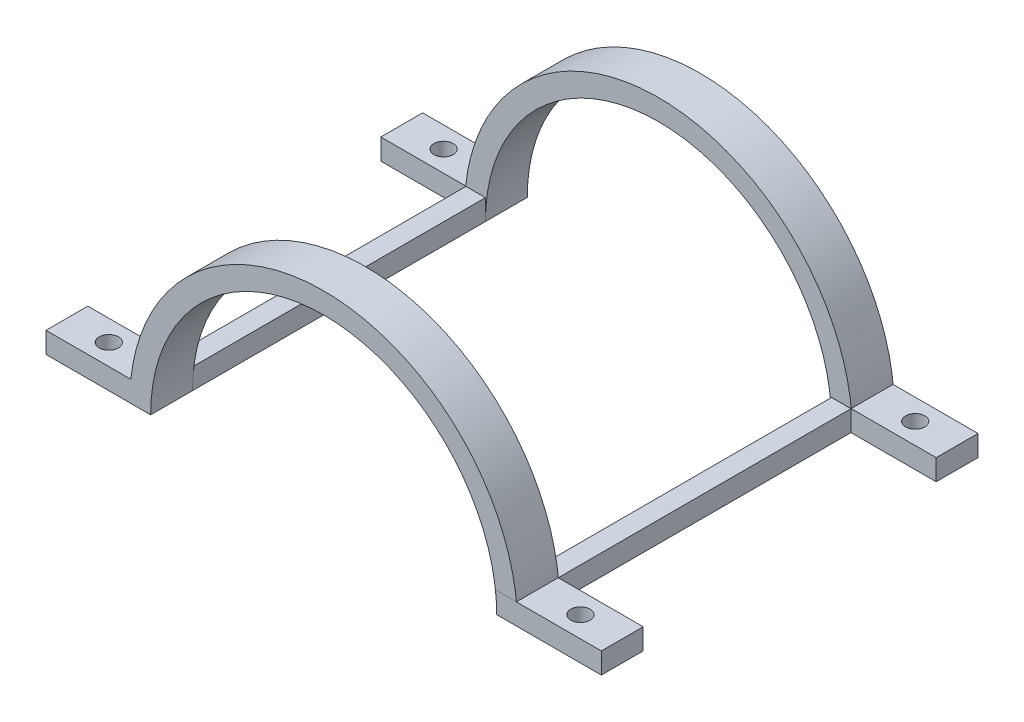
from build123d import *

# Parameters (mm, degrees)
BOSS_EXTRUDE1_DEPTH     = 10
SKETCH2_W               = 10
SKETCH2_H               = 5
BOSS_EXTRUDE2_DEPTH     = 66.35
SKETCH3_R               = 2.3
CUT_EXTRUDE1_DEPTH      = 132.7
SKETCH4_R               = 41.35
CUT_EXTRUDE3_DEPTH      = 50
LPATTERN4_START         = 80
LPATTERN4_DEPTH         = 10
LPATTERN4_2_DEPTH       = 10
LPATTERN4_3_DEPTH       = 10
MIRROR5_COPY_1_SKETCH_R = 2.3
MIRROR5_COPY_1_DEPTH    = 132.7
SKETCH8_W               = 4.648420871
SKETCH8_H               = 4.94728133
BOSS_EXTRUDE3_DEPTH     = 40


# Read off the part's stored shape, not the designer's step: LPattern4
with BuildPart() as part:
    # Sketch1 → Boss-Extrude1 (new body)
    with BuildSketch(Plane.XY):
        with BuildLine():
            Line((-46.35, 0), (-41.35, 0))
            ThreePointArc((-41.35, 0), (0, 41.35), (41.35, 0))
            Line((41.35, 0), (46.35, 0))
            ThreePointArc((46.35, 0), (0, 46.35), (-46.35, 0))
        make_face()
    extrude(amount=BOSS_EXTRUDE1_DEPTH)



with BuildPart() as body_2:
    # Sketch2 → Boss-Extrude2 (new, symmetric)
    with BuildSketch(Plane(origin=(0, 0, 0), x_dir=(0, 0, -1), z_dir=(1, 0, 0))):
        with Locations((-5, 2.5)):
            Rectangle(SKETCH2_W, SKETCH2_H)
    extrude(amount=BOSS_EXTRUDE2_DEPTH, both=True)

    # Sketch3 → Cut-Extrude1 (cut)
    with BuildSketch(Plane(origin=(0, 5, 0), x_dir=(1, 0, 0), z_dir=(0, 1, 0))):
        with Locations(Location((56.35, -5, 0), (0, 0, 270))):
            Circle(SKETCH3_R)
    cut_extrude1 = extrude(amount=-CUT_EXTRUDE1_DEPTH, mode=Mode.SUBTRACT)

    # Mirror1: Cut-Extrude1 across plane
    add(cut_extrude1.mirror(Plane(origin=(0, 0, 0), x_dir=(0, 0, 1), z_dir=(1, 0, 0))), mode=Mode.SUBTRACT)

    # Sketch4 → Cut-Extrude3 (cut, symmetric)
    with BuildSketch(Plane.XY):
        Circle(SKETCH4_R)
    extrude(amount=CUT_EXTRUDE3_DEPTH, both=True, mode=Mode.SUBTRACT)


with BuildPart() as cut_extrude3_piece_1:
    # of the separate pieces the step leaves, piece 1, a body of its own (cut_extrude3_pieces)
    add(body_2.part.solids().sort_by_distance((-41.35, 0, 10))[0])


with BuildPart() as cut_extrude3_piece_2:
    # of the separate pieces the step leaves, piece 2, a body of its own (cut_extrude3_pieces)
    add(body_2.part.solids().sort_by_distance((66.35, 0, 10))[0])


with BuildPart() as body_4:
    # LPattern4 outline → LPattern4 (new body)
    with BuildSketch(Plane.XY.offset(LPATTERN4_START)):
        with BuildLine():
            Line((66.35, 0), (66.35, 5))
            Line((66.35, 5), (41.046589383, 5))
            ThreePointArc((41.046589383, 5), (41.274077646, 2.504598671), (41.35, 0))
            Line((41.35, 0), (66.35, 0))
        make_face()
    extrude(amount=LPATTERN4_DEPTH)

    # Mirror5: Cut-Extrude1 across plane
    add(cut_extrude1.mirror(Plane.XY.offset(45)), mode=Mode.SUBTRACT)


with BuildPart() as body_5:
    # LPattern4 2 outline → LPattern4 2 (new body)
    with BuildSketch(Plane.XY.offset(LPATTERN4_START)):
        with BuildLine():
            Line((-46.35, 0), (-41.35, 0))
            ThreePointArc((-41.35, 0), (0, 41.35), (41.35, 0))
            Line((41.35, 0), (46.35, 0))
            ThreePointArc((46.35, 0), (0, 46.35), (-46.35, 0))
        make_face()
    extrude(amount=LPATTERN4_2_DEPTH)


with BuildPart() as body_6:
    # LPattern4 3 outline → LPattern4 3 (new body)
    with BuildSketch(Plane.XY.offset(LPATTERN4_START)):
        with BuildLine():
            Line((-66.35, 0), (-41.35, 0))
            ThreePointArc((-41.35, 0), (-41.274077646, 2.504598671), (-41.046589383, 5))
            Line((-41.046589383, 5), (-66.35, 5))
            Line((-66.35, 5), (-66.35, 0))
        make_face()
    extrude(amount=LPATTERN4_3_DEPTH)

    # Mirror5 copy 1 sketch → Mirror5 copy 1 (cut)
    with BuildSketch(Plane(origin=(0, 5, 90), x_dir=(-1, 0, 0), z_dir=(0, 1, 0))):
        with Locations(Location((56.35, -5, 0), (0, 0, 270))):
            Circle(MIRROR5_COPY_1_SKETCH_R)
    extrude(amount=-MIRROR5_COPY_1_DEPTH, mode=Mode.SUBTRACT)


with BuildPart() as part_1:
    add(part.part)

    add(cut_extrude3_piece_1.part)  # Boss-Extrude3 merges Cut-Extrude3 piece 1

    add(body_5.part)  # Boss-Extrude3 merges body 5

    add(body_6.part)  # Boss-Extrude3 merges body 6
    # Sketch8 → Boss-Extrude3 (add, symmetric)
    with BuildSketch(Plane.XY.offset(45)):
        with Locations((-43.674210436, 2.473640665)):
            Rectangle(SKETCH8_W, SKETCH8_H)
    boss_extrude3 = extrude(amount=BOSS_EXTRUDE3_DEPTH, both=True)

    # Mirror6: Boss-Extrude3 across plane
    add(boss_extrude3.mirror(Plane(origin=(0, 0, 0), x_dir=(0, 0, 1), z_dir=(1, 0, 0))))


solid = Compound([cut_extrude3_piece_2.part, body_4.part, part_1.part])
